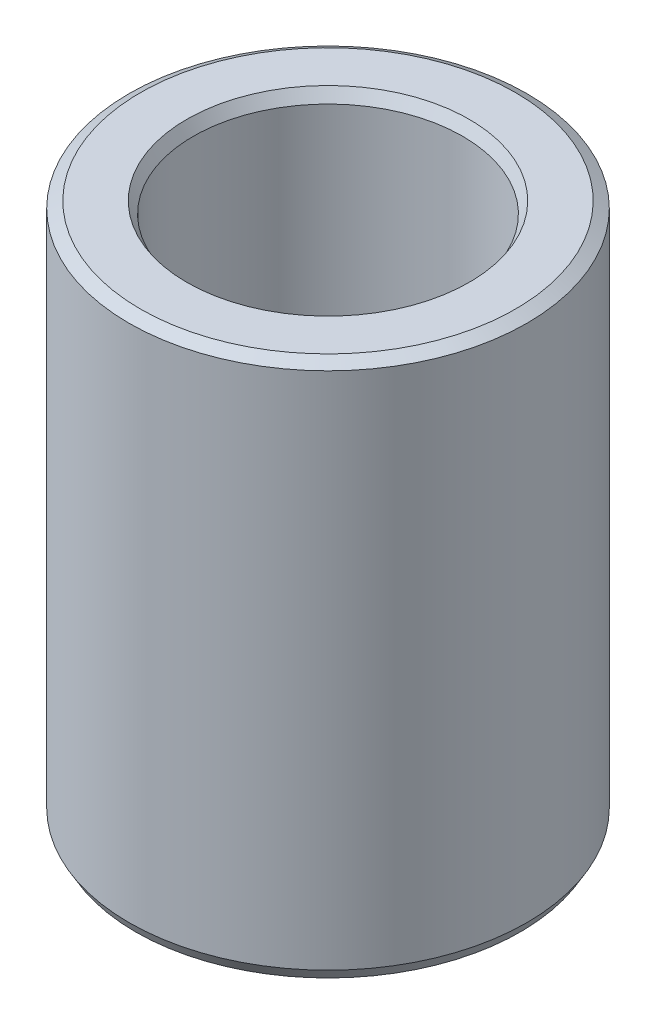
from build123d import *
from OCP.BRepFilletAPI import BRepFilletAPI_MakeChamfer

# Parameters (mm, degrees)
SKETCH1_R           = 57.5
BOSS_EXTRUDE1_DEPTH = 155.236634701
SKETCH2_R           = 38.927102746
CUT_EXTRUDE1_DEPTH  = 176.245293099
CHAMFER1_SIZE       = 1.902155207
CHAMFER1_SIZE2      = 3.294629462


with BuildPart() as part:
    # Sketch1 → Boss-Extrude1 (new body)
    with BuildSketch(Plane(origin=(0, 0, 0), x_dir=(1, 0, 0), z_dir=(0, 1, 0))):
        Circle(SKETCH1_R)
    extrude(amount=BOSS_EXTRUDE1_DEPTH)

    # Sketch2 → Cut-Extrude1 (cut, through all)
    with BuildSketch(Plane(origin=(0, 0, 0), x_dir=(1, 0, 0), z_dir=(0, 1, 0))):
        Circle(SKETCH2_R)
    extrude(amount=CUT_EXTRUDE1_DEPTH, mode=Mode.SUBTRACT)

    # Chamfer1: one chamfer whose edges measure the first distance from different faces: ONE call of the kernel's chamfer builder (chamfer() names one face for all edges)
    chamfer1_edges_1 = [part.edges().sort_by_distance(p)[0] for p in [
        (-38.927102746, 155.236634701, 0),
    ]]
    chamfer1_side_1 = [part.faces().sort_by_distance(p)[0] for p in [
        (-55.873654403, 155.236634701, 0),
    ]]
    chamfer1_edges_2 = [part.edges().sort_by_distance(p)[0] for p in [
        (-38.927102746, 0, 0),
    ]]
    chamfer1_side_2 = [part.faces().sort_by_distance(p)[0] for p in [
        (-38.927102746, 77.618317351, 0),
    ]]
    chamfer1_edges_3 = [part.edges().sort_by_distance(p)[0] for p in [
        (-57.5, 0, 0),
    ]]
    chamfer1_side_3 = [part.faces().sort_by_distance(p)[0] for p in [
        (-55.873654403, 0, 0),
    ]]
    chamfer1_edges_4 = [part.edges().sort_by_distance(p)[0] for p in [
        (-57.5, 155.236634701, 0),
    ]]
    chamfer1_side_4 = [part.faces().sort_by_distance(p)[0] for p in [
        (-57.5, 77.618317351, 0),
    ]]
    chamfer1 = BRepFilletAPI_MakeChamfer(part.part.solid().wrapped)
    for e in chamfer1_edges_1:
        chamfer1.Add(CHAMFER1_SIZE, CHAMFER1_SIZE2, e.wrapped, chamfer1_side_1[0].wrapped)  # the first distance lies on this face
    for e in chamfer1_edges_2:
        chamfer1.Add(CHAMFER1_SIZE, CHAMFER1_SIZE2, e.wrapped, chamfer1_side_2[0].wrapped)  # the first distance lies on this face
    for e in chamfer1_edges_3:
        chamfer1.Add(CHAMFER1_SIZE, CHAMFER1_SIZE2, e.wrapped, chamfer1_side_3[0].wrapped)  # the first distance lies on this face
    for e in chamfer1_edges_4:
        chamfer1.Add(CHAMFER1_SIZE, CHAMFER1_SIZE2, e.wrapped, chamfer1_side_4[0].wrapped)  # the first distance lies on this face
    add(Compound.cast(chamfer1.Shape()), mode=Mode.REPLACE)


solid = part.part
